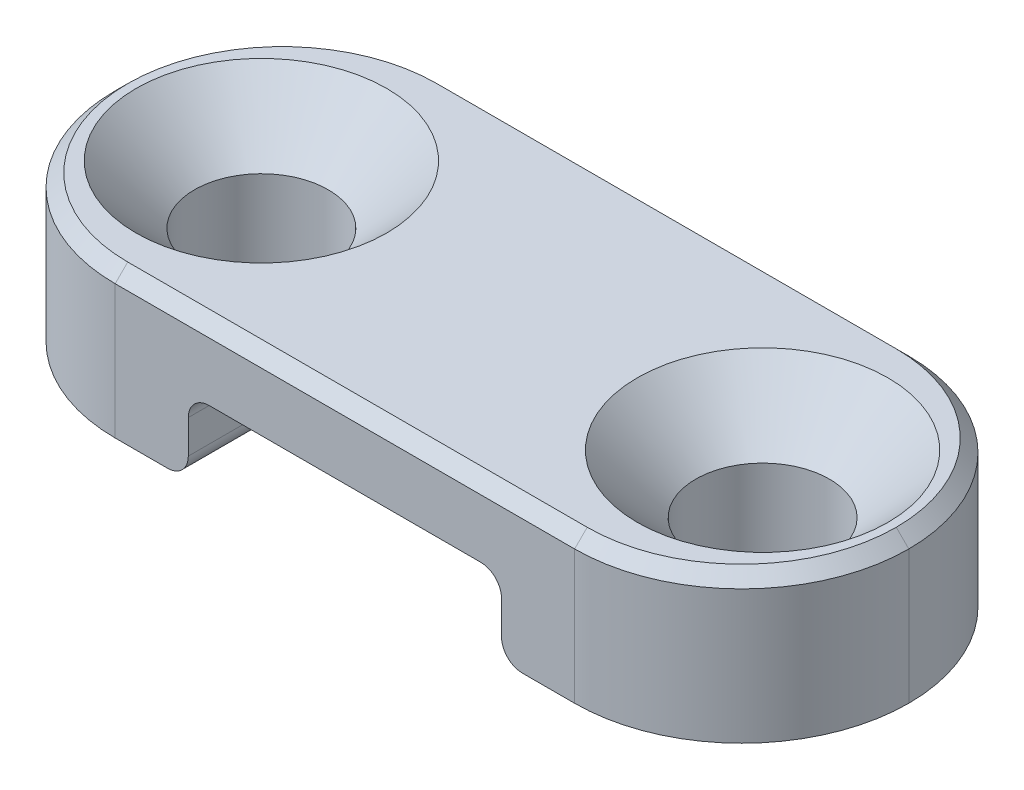
from build123d import *

# Parameters (mm, degrees)
SKETCH_1_W                   = 19
SKETCH_1_H                   = 8
EXTRUDE_1_DEPTH              = 1.75
CUT_EXTRUDE_1_REACH          = 14.542
SKETCH_2_W                   = 7.5
SKETCH_2_H                   = 1.8
HOLE_WIZARD_M3_1_D           = 3.2
HOLE_WIZARD_M3_1_CSINK_D     = 6
HOLE_WIZARD_M3_1_CSINK_ANGLE = 90
FILLET_2_R                   = 4
FILLET_3_R                   = 0.5
CHAMFER_1_SIZE               = 0.3


with BuildPart() as part:
    # 草图1 → 凸台-拉伸1 (new, symmetric)
    with BuildSketch(Plane(origin=(0, 0, 0), x_dir=(1, 0, 0), z_dir=(0, 1, 0))):
        Rectangle(SKETCH_1_W, SKETCH_1_H)
    extrude(amount=EXTRUDE_1_DEPTH, both=True)

    # 草图2 → 切除-拉伸1 (cut, up to next)
    with BuildSketch(Plane.XY.offset(4), mode=Mode.PRIVATE) as cut_extrude_1_sk1:
        with Locations((0, -0.85)):
            Rectangle(SKETCH_2_W, SKETCH_2_H)
    cut_extrude_1_tool1 = extrude(cut_extrude_1_sk1.sketch, amount=-CUT_EXTRUDE_1_REACH, mode=Mode.PRIVATE) & part.part
    add(cut_extrude_1_tool1.solids().sort_by_distance((0, -0.85, 4))[0], mode=Mode.SUBTRACT)

    # M3 十字槽半沉头木螺钉的锥形沉头孔1 (through all)
    with Locations(Plane(origin=(0, 1.75, 0), x_dir=(1, 0, 0), z_dir=(0, 1, 0))):
        with Locations((6, 0), (-6, 0)):
            CounterSinkHole(HOLE_WIZARD_M3_1_D / 2, HOLE_WIZARD_M3_1_CSINK_D / 2, counter_sink_angle=HOLE_WIZARD_M3_1_CSINK_ANGLE)

    # 圆角2
    fillet_2_edges = [part.edges().sort_by_distance(p)[0] for p in [
        (9.5, 0, 4),
        (-9.5, 0, -4),
        (9.5, 0, -4),
        (-9.5, 0, 4),
    ]]
    fillet(fillet_2_edges, radius=FILLET_2_R - 0.0001)  # a hair under: the kernel refuses the full size

    # 圆角3
    fillet_3_edges = [part.edges().sort_by_distance(p)[0] for p in [
        (3.75, 0.05, 0),
        (3.75, -1.75, 0),
        (-3.75, -1.75, 0),
        (-3.75, 0.05, 0),
    ]]
    fillet(fillet_3_edges, radius=FILLET_3_R)

    # 倒角1
    chamfer_1_edges = [part.edges().sort_by_distance(p)[0] for p in [
        (0, 1.75, 4),
        (0, 1.75, -4),
        (-8.328456414, 1.75, 2.828456414),
        (-8.328456414, 1.75, -2.828456414),
        (8.328456414, 1.75, -2.828456414),
        (8.328456414, 1.75, 2.828456414),
    ]]
    chamfer(chamfer_1_edges, length=CHAMFER_1_SIZE)


solid = part.part
